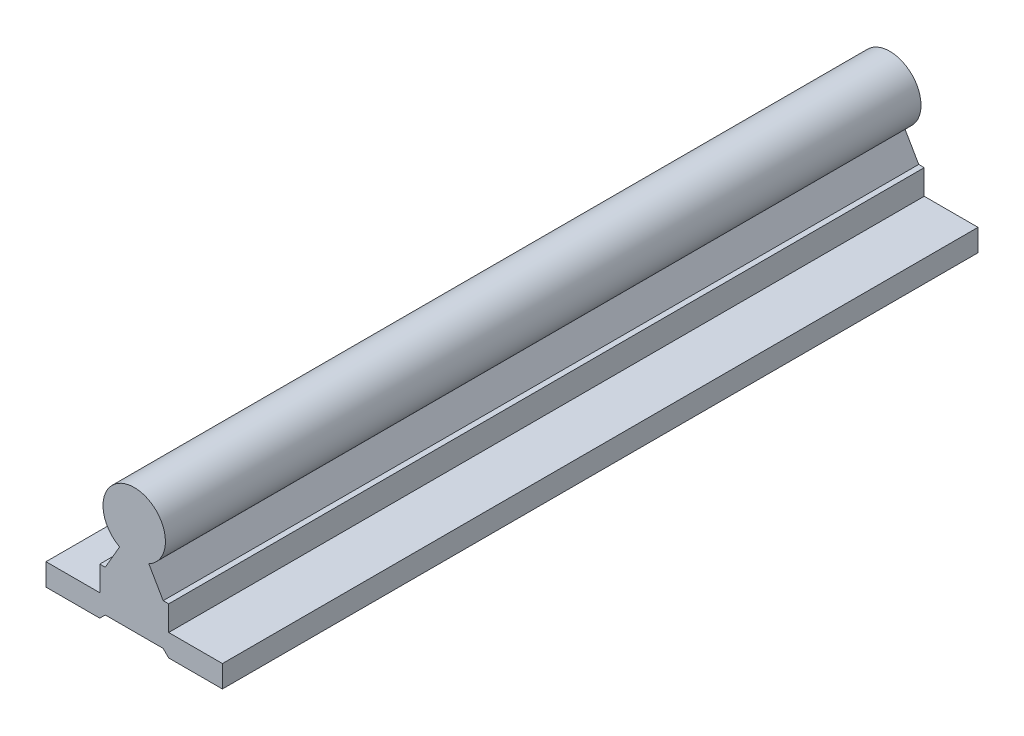
from build123d import *

# Parameters (mm, degrees)
EXTRUDE_1_DEPTH     = 68.52
SKETCH_2_W          = 10.5
SKETCH_2_H          = 1
CUT_EXTRUDE_1_DEPTH = 140.984803019
CHAMFER_1_SIZE      = 1


with BuildPart() as part:
    # 草图1 → 凸台-拉伸1 (new, symmetric)
    with BuildSketch(Plane.XY):
        with BuildLine():
            Line((-16, 0), (16, 0))
            Line((16, 0), (16, 4))
            Line((16, 4), (6.25, 4))
            Line((6.25, 4), (6.25, 8.5))
            Line((6.25, 8.5), (5.25, 8.5))
            Line((5.25, 8.5), (2.651923789, 13))
            ThreePointArc((2.651923789, 13), (0, 23.659743791), (-2.651923789, 13))
            Line((-2.651923789, 13), (-5.25, 8.5))
            Line((-5.25, 8.5), (-6.25, 8.5))
            Line((-6.25, 8.5), (-6.25, 4))
            Line((-6.25, 4), (-16, 4))
            Line((-16, 4), (-16, 0))
        make_face()
    extrude(amount=EXTRUDE_1_DEPTH, both=True)

    # 草图2 → 切除-拉伸1 (cut, through all)
    with BuildSketch(Plane.XY.offset(68.52)):
        with Locations((0, 0.5)):
            Rectangle(SKETCH_2_W, SKETCH_2_H)
    extrude(amount=-CUT_EXTRUDE_1_DEPTH, mode=Mode.SUBTRACT)

    # 倒角1
    chamfer_1_edges = [part.edges().sort_by_distance(p)[0] for p in [
        (5.25, 0, 0),
        (-5.25, 0, 0),
    ]]
    chamfer(chamfer_1_edges, length=CHAMFER_1_SIZE - 0.0001)  # a hair under: the kernel refuses the full size


solid = part.part
